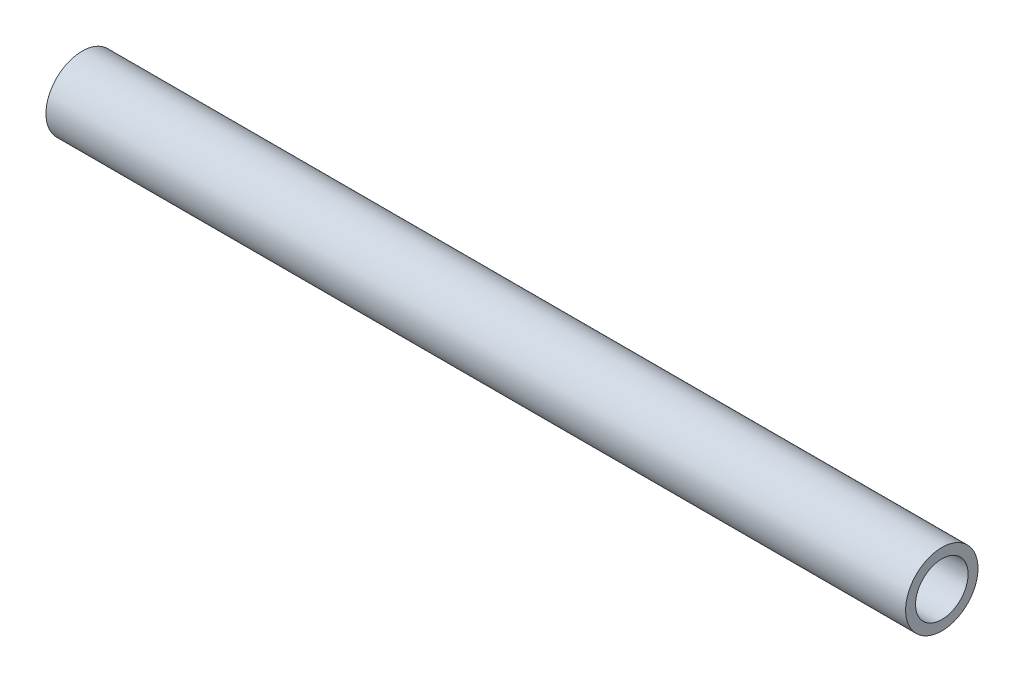
from build123d import *

# Parameters (mm, degrees)
SKETCH1_R           = 13.15
SKETCH1_R_2         = 9.55
BOSS_EXTRUDE1_DEPTH = 312.4


with BuildPart() as part:
    # Sketch1 → Boss-Extrude1 (new body)
    with BuildSketch(Plane(origin=(0, 0, 0), x_dir=(0, 0, -1), z_dir=(1, 0, 0))):
        Circle(SKETCH1_R)
        Circle(SKETCH1_R_2, mode=Mode.SUBTRACT)
    extrude(amount=BOSS_EXTRUDE1_DEPTH)


solid = part.part
